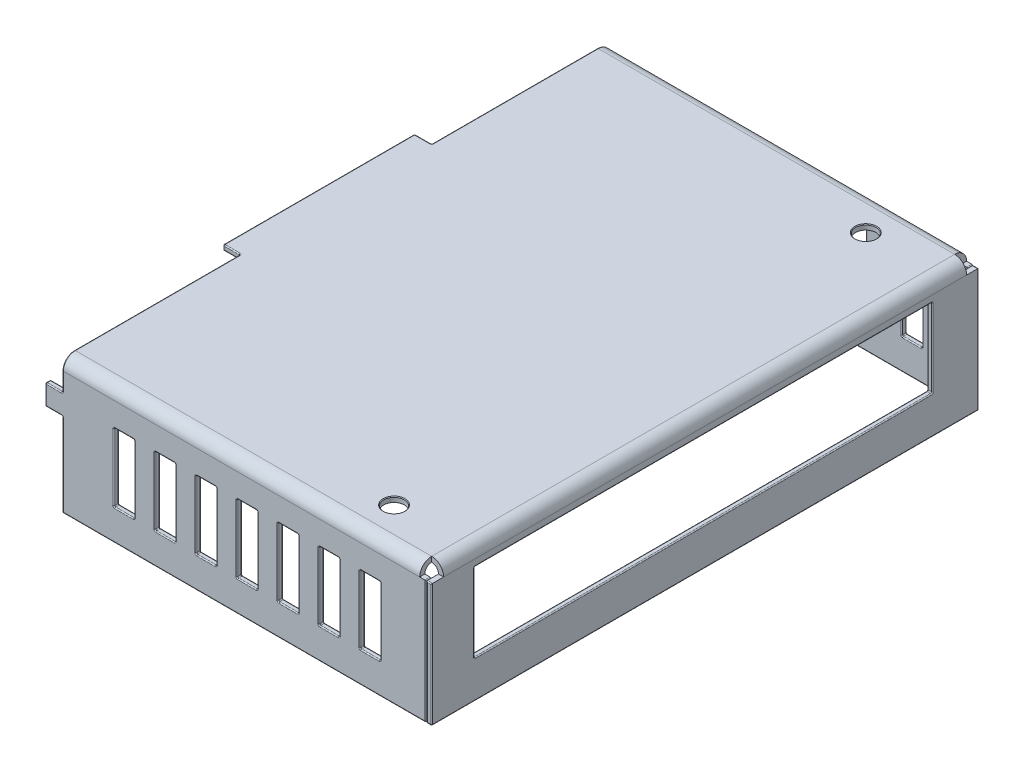
from build123d import *

# Parameters (mm, degrees)
BASE_FLANGE_DEPTH              = 53.25
SKETCH2_W                      = 2.5
SKETCH2_H                      = 28
TOP_TAB_DEPTH                  = 0.75
SKETCH5_W                      = 2.5
SKETCH5_H                      = 3
SIDE_TAB_1_DEPTH               = 0.75
EDGE_FLANGE_START              = -40
EDGE_FLANGE_DEPTH              = 80
EDGE_FLANGE_2_DEPTH            = 1.75
EDGE_FLANGE_START_2            = 38.25
EDGE_FLANGE_3_DEPTH            = 1.75
EDGE_FLANGE_START_3            = -38.25
EDGE_FLANGE_4_DEPTH            = 76.5
CLOSED_START                   = 53.15
CLOSED_CORNER_OUTLINE_W        = 18
CLOSED_CORNER_OUTLINE_H        = 0.75
CLOSED_CORNER_DEPTH            = 0.1
CLOSED_START_2                 = 53.25
CLOSED_CORNER_2_OUTLINE_W      = 18
CLOSED_CORNER_2_OUTLINE_H      = 1.75
CLOSED_CORNER_2_DEPTH          = 0.75
VENTILATION_HOLES_L_REACH      = 100.519
VENTILATION_HOLES_L_SKETCH_W   = 3
VENTILATION_HOLES_L_SKETCH_H   = 10
VENTILATION_HOLES_R_REACH      = 100.519
VENTILATION_HOLES_R_SKETCH_W   = 3
VENTILATION_HOLES_R_SKETCH_H   = 10
VENTILATION_HOLES_R_SKETCH_W_2 = 19
VENTILATION_HOLES_R_SKETCH_H_2 = 10.5
FRONT_HOLES_REACH              = 73.988
FRONT_HOLES_SKETCH_W           = 67
FRONT_HOLES_SKETCH_H           = 11.5
F_3_0_3_HOLES_D                = 3
F_3_0_3_HOLES_DEPTH            = 5.5
F_3_0_3_HOLES_CSINK_D          = 3.2
F_3_0_3_HOLES_CSINK_ANGLE      = 90
F_3_0_3_HOLES_TIP              = 0.901290929
PRODUCTION_FILLET_1_R          = 0.15


# Read off the part's stored shape, not the designer's step: Base-Flange, Edge-Flange, Closed Corner
# Sheet-metal steps are written as plain solids
with BuildPart() as part:
    # Base-Flange outline → Base-Flange (new body)
    with BuildSketch(Plane(origin=(0, 0, 0), x_dir=(0, 0, -1), z_dir=(1, 0, 0))):
        with BuildLine():
            Line((39.25, -1.75), (39.25, -19.75))
            Line((39.25, -19.75), (40, -19.75))
            Line((40, -19.75), (40, -1.75))
            ThreePointArc((40, -1.75), (39.487436867, -0.512563133), (38.25, 0))
            Line((38.25, 0), (-38.25, 0))
            ThreePointArc((-38.25, 0), (-39.487436867, -0.512563133), (-40, -1.75))
            Line((-40, -1.75), (-40, -19.75))
            Line((-40, -19.75), (-39.25, -19.75))
            Line((-39.25, -19.75), (-39.25, -1.75))
            ThreePointArc((-39.25, -1.75), (-38.957106781, -1.042893219), (-38.25, -0.75))
            Line((-38.25, -0.75), (38.25, -0.75))
            ThreePointArc((38.25, -0.75), (38.957106781, -1.042893219), (39.25, -1.75))
        make_face()
    extrude(amount=BASE_FLANGE_DEPTH)

    # Sketch2 → Top Tab (add)
    with BuildSketch(Plane(origin=(0, 0, 0), x_dir=(1, 0, 0), z_dir=(0, 1, 0))):
        with Locations((-1.25, 0)):
            Rectangle(SKETCH2_W, SKETCH2_H)
    extrude(amount=-TOP_TAB_DEPTH)

    # Sketch5 → Side Tab 1 (add)
    with BuildSketch(Plane.XY.offset(40)):
        with Locations((-1.25, -6)):
            Rectangle(SKETCH5_W, SKETCH5_H)
    side_tab_1 = extrude(amount=-SIDE_TAB_1_DEPTH)

    # Side Tab 2: Side Tab 1 across plane
    add(side_tab_1.mirror(Plane.XY))

    # Edge-Flange outline → Edge-Flange (cut)
    with BuildSketch(Plane.XY.offset(EDGE_FLANGE_START)):
        with BuildLine():
            Line((52.25, -1.75), (53.25, -1.75))
            ThreePointArc((53.25, -1.75), (52.957106781, -1.042893219), (52.25, -0.75))
            Line((52.25, -0.75), (52.25, -1.75))
        make_face()
        with BuildLine():
            Line((53.25, 0), (52.25, 0))
            ThreePointArc((52.25, 0), (52.774048587, -0.08030749), (53.25, -0.313859338))
            Line((53.25, -0.313859338), (53.25, 0))
        make_face()
    extrude(amount=EDGE_FLANGE_DEPTH, mode=Mode.SUBTRACT)

    # Edge-Flange 2 outline → Edge-Flange 2 (cut)
    with BuildSketch(Plane.XY.offset(EDGE_FLANGE_START)):
        with BuildLine():
            ThreePointArc((52.25, -0.75), (52.957106781, -1.042893219), (53.25, -1.75))
            Line((53.25, -1.75), (53.25, -0.313859338))
            ThreePointArc((53.25, -0.313859338), (52.774048587, -0.08030749), (52.25, 0))
            Line((52.25, 0), (52.25, -0.75))
        make_face()
    extrude(amount=EDGE_FLANGE_2_DEPTH, mode=Mode.SUBTRACT)

    # Edge-Flange 3 outline → Edge-Flange 3 (cut)
    with BuildSketch(Plane.XY.offset(EDGE_FLANGE_START_2)):
        with BuildLine():
            ThreePointArc((52.25, -0.75), (52.957106781, -1.042893219), (53.25, -1.75))
            Line((53.25, -1.75), (53.25, -0.313859338))
            ThreePointArc((53.25, -0.313859338), (52.774048587, -0.08030749), (52.25, 0))
            Line((52.25, 0), (52.25, -0.75))
        make_face()
    extrude(amount=EDGE_FLANGE_3_DEPTH, mode=Mode.SUBTRACT)

    # Edge-Flange 4 outline → Edge-Flange 4 (add)
    with BuildSketch(Plane.XY.offset(EDGE_FLANGE_START_3)):
        with BuildLine():
            Line((53.25, -0.313859338), (53.25, -0.75))
            Line((53.25, -0.75), (52.25, -0.75))
            ThreePointArc((52.25, -0.75), (52.957106781, -1.042893219), (53.25, -1.75))
            Line((53.25, -1.75), (53.25, -19.75))
            Line((53.25, -19.75), (54, -19.75))
            Line((54, -19.75), (54, -1.75))
            ThreePointArc((54, -1.75), (53.801209206, -0.939907413), (53.25, -0.313859338))
        make_face()
    extrude(amount=EDGE_FLANGE_4_DEPTH)

    # Closed Corner outline → Closed Corner (cut)
    with BuildSketch(Plane.YZ.offset(CLOSED_START)):
        with Locations((-10.75, 39.625)):
            Rectangle(CLOSED_CORNER_OUTLINE_W, CLOSED_CORNER_OUTLINE_H)
        with Locations((-10.75, -39.625)):
            Rectangle(CLOSED_CORNER_OUTLINE_W, CLOSED_CORNER_OUTLINE_H)
    extrude(amount=CLOSED_CORNER_DEPTH, mode=Mode.SUBTRACT)

    # Closed Corner 2 outline → Closed Corner 2 (add)
    with BuildSketch(Plane.YZ.offset(CLOSED_START_2)):
        with Locations((-10.75, -39.125)):
            Rectangle(CLOSED_CORNER_2_OUTLINE_W, CLOSED_CORNER_2_OUTLINE_H)
        with Locations((-10.75, 39.125)):
            Rectangle(CLOSED_CORNER_2_OUTLINE_W, CLOSED_CORNER_2_OUTLINE_H)
    extrude(amount=CLOSED_CORNER_2_DEPTH)

    # Ventilation Holes L Sketch → Ventilation Holes L (cut, up to next)
    with BuildSketch(Plane.XY.offset(40), mode=Mode.PRIVATE) as ventilation_holes_l_sk1:
        with Locations((9, -10.25)):
            Rectangle(VENTILATION_HOLES_L_SKETCH_W, VENTILATION_HOLES_L_SKETCH_H)
    ventilation_holes_l_tool1 = extrude(ventilation_holes_l_sk1.sketch, amount=-VENTILATION_HOLES_L_REACH, mode=Mode.PRIVATE) & part.part
    # Ventilation Holes L Sketch → Ventilation Holes L (cut, up to next)
    with BuildSketch(Plane.XY.offset(40), mode=Mode.PRIVATE) as ventilation_holes_l_sk2:
        with Locations((15, -10.25)):
            Rectangle(VENTILATION_HOLES_L_SKETCH_W, VENTILATION_HOLES_L_SKETCH_H)
    ventilation_holes_l_tool2 = extrude(ventilation_holes_l_sk2.sketch, amount=-VENTILATION_HOLES_L_REACH, mode=Mode.PRIVATE) & part.part
    # Ventilation Holes L Sketch → Ventilation Holes L (cut, up to next)
    with BuildSketch(Plane.XY.offset(40), mode=Mode.PRIVATE) as ventilation_holes_l_sk3:
        with Locations((21, -10.25)):
            Rectangle(VENTILATION_HOLES_L_SKETCH_W, VENTILATION_HOLES_L_SKETCH_H)
    ventilation_holes_l_tool3 = extrude(ventilation_holes_l_sk3.sketch, amount=-VENTILATION_HOLES_L_REACH, mode=Mode.PRIVATE) & part.part
    # Ventilation Holes L Sketch → Ventilation Holes L (cut, up to next)
    with BuildSketch(Plane.XY.offset(40), mode=Mode.PRIVATE) as ventilation_holes_l_sk4:
        with Locations((27, -10.25)):
            Rectangle(VENTILATION_HOLES_L_SKETCH_W, VENTILATION_HOLES_L_SKETCH_H)
    ventilation_holes_l_tool4 = extrude(ventilation_holes_l_sk4.sketch, amount=-VENTILATION_HOLES_L_REACH, mode=Mode.PRIVATE) & part.part
    # Ventilation Holes L Sketch → Ventilation Holes L (cut, up to next)
    with BuildSketch(Plane.XY.offset(40), mode=Mode.PRIVATE) as ventilation_holes_l_sk5:
        with Locations((33, -10.25)):
            Rectangle(VENTILATION_HOLES_L_SKETCH_W, VENTILATION_HOLES_L_SKETCH_H)
    ventilation_holes_l_tool5 = extrude(ventilation_holes_l_sk5.sketch, amount=-VENTILATION_HOLES_L_REACH, mode=Mode.PRIVATE) & part.part
    # Ventilation Holes L Sketch → Ventilation Holes L (cut, up to next)
    with BuildSketch(Plane.XY.offset(40), mode=Mode.PRIVATE) as ventilation_holes_l_sk6:
        with Locations((39, -10.25)):
            Rectangle(VENTILATION_HOLES_L_SKETCH_W, VENTILATION_HOLES_L_SKETCH_H)
    ventilation_holes_l_tool6 = extrude(ventilation_holes_l_sk6.sketch, amount=-VENTILATION_HOLES_L_REACH, mode=Mode.PRIVATE) & part.part
    # Ventilation Holes L Sketch → Ventilation Holes L (cut, up to next)
    with BuildSketch(Plane.XY.offset(40), mode=Mode.PRIVATE) as ventilation_holes_l_sk7:
        with Locations((45, -10.25)):
            Rectangle(VENTILATION_HOLES_L_SKETCH_W, VENTILATION_HOLES_L_SKETCH_H)
    ventilation_holes_l_tool7 = extrude(ventilation_holes_l_sk7.sketch, amount=-VENTILATION_HOLES_L_REACH, mode=Mode.PRIVATE) & part.part
    add(ventilation_holes_l_tool1.solids().sort_by_distance((9, -10.25, 40))[0], mode=Mode.SUBTRACT)
    add(ventilation_holes_l_tool2.solids().sort_by_distance((15, -10.25, 40))[0], mode=Mode.SUBTRACT)
    add(ventilation_holes_l_tool3.solids().sort_by_distance((21, -10.25, 40))[0], mode=Mode.SUBTRACT)
    add(ventilation_holes_l_tool4.solids().sort_by_distance((27, -10.25, 40))[0], mode=Mode.SUBTRACT)
    add(ventilation_holes_l_tool5.solids().sort_by_distance((33, -10.25, 40))[0], mode=Mode.SUBTRACT)
    add(ventilation_holes_l_tool6.solids().sort_by_distance((39, -10.25, 40))[0], mode=Mode.SUBTRACT)
    add(ventilation_holes_l_tool7.solids().sort_by_distance((45, -10.25, 40))[0], mode=Mode.SUBTRACT)

    # Ventilation Holes R Sketch → Ventilation Holes R (cut, up to next)
    with BuildSketch(Plane(origin=(0, 0, -40), x_dir=(-1, 0, 0), z_dir=(0, 0, -1)), mode=Mode.PRIVATE) as ventilation_holes_r_sk1:
        with Locations((-9, -10.25)):
            Rectangle(VENTILATION_HOLES_R_SKETCH_W, VENTILATION_HOLES_R_SKETCH_H)
    ventilation_holes_r_tool1 = extrude(ventilation_holes_r_sk1.sketch, amount=-VENTILATION_HOLES_R_REACH, mode=Mode.PRIVATE) & part.part
    # Ventilation Holes R Sketch → Ventilation Holes R (cut, up to next)
    with BuildSketch(Plane(origin=(0, 0, -40), x_dir=(-1, 0, 0), z_dir=(0, 0, -1)), mode=Mode.PRIVATE) as ventilation_holes_r_sk2:
        with Locations((-15, -10.25)):
            Rectangle(VENTILATION_HOLES_R_SKETCH_W, VENTILATION_HOLES_R_SKETCH_H)
    ventilation_holes_r_tool2 = extrude(ventilation_holes_r_sk2.sketch, amount=-VENTILATION_HOLES_R_REACH, mode=Mode.PRIVATE) & part.part
    # Ventilation Holes R Sketch → Ventilation Holes R (cut, up to next)
    with BuildSketch(Plane(origin=(0, 0, -40), x_dir=(-1, 0, 0), z_dir=(0, 0, -1)), mode=Mode.PRIVATE) as ventilation_holes_r_sk3:
        with Locations((-45, -10.25)):
            Rectangle(VENTILATION_HOLES_R_SKETCH_W, VENTILATION_HOLES_R_SKETCH_H)
    ventilation_holes_r_tool3 = extrude(ventilation_holes_r_sk3.sketch, amount=-VENTILATION_HOLES_R_REACH, mode=Mode.PRIVATE) & part.part
    # Ventilation Holes R Sketch → Ventilation Holes R (cut, up to next)
    with BuildSketch(Plane(origin=(0, 0, -40), x_dir=(-1, 0, 0), z_dir=(0, 0, -1)), mode=Mode.PRIVATE) as ventilation_holes_r_sk4:
        with Locations((-28.75, -8)):
            Rectangle(VENTILATION_HOLES_R_SKETCH_W_2, VENTILATION_HOLES_R_SKETCH_H_2)
    ventilation_holes_r_tool4 = extrude(ventilation_holes_r_sk4.sketch, amount=-VENTILATION_HOLES_R_REACH, mode=Mode.PRIVATE) & part.part
    add(ventilation_holes_r_tool1.solids().sort_by_distance((9, -10.25, -40))[0], mode=Mode.SUBTRACT)
    add(ventilation_holes_r_tool2.solids().sort_by_distance((15, -10.25, -40))[0], mode=Mode.SUBTRACT)
    add(ventilation_holes_r_tool3.solids().sort_by_distance((45, -10.25, -40))[0], mode=Mode.SUBTRACT)
    add(ventilation_holes_r_tool4.solids().sort_by_distance((28.75, -8, -40))[0], mode=Mode.SUBTRACT)

    # Front Holes Sketch → Front Holes (cut, up to next)
    with BuildSketch(Plane(origin=(54, 0, 0), x_dir=(0, 0, -1), z_dir=(1, 0, 0)), mode=Mode.PRIVATE) as front_holes_sk1:
        with Locations((-0.25, -8.5)):
            Rectangle(FRONT_HOLES_SKETCH_W, FRONT_HOLES_SKETCH_H)
    front_holes_tool1 = extrude(front_holes_sk1.sketch, amount=-FRONT_HOLES_REACH, mode=Mode.PRIVATE) & part.part
    add(front_holes_tool1.solids().sort_by_distance((54, -8.5, 0.25))[0], mode=Mode.SUBTRACT)

    # Ø3.0 (3) Holes
    with Locations(Plane(origin=(0, 0, 0), x_dir=(1, 0, 0), z_dir=(0, 1, 0))):
        with Locations((43, -34.5), (43, 34.5)):
            CounterSinkHole(F_3_0_3_HOLES_D / 2, F_3_0_3_HOLES_CSINK_D / 2, depth=F_3_0_3_HOLES_DEPTH, counter_sink_angle=F_3_0_3_HOLES_CSINK_ANGLE)
            with Locations((0, 0, -(F_3_0_3_HOLES_DEPTH + F_3_0_3_HOLES_TIP / 2))):  # 118° drill point
                Cone(0, F_3_0_3_HOLES_D / 2, F_3_0_3_HOLES_TIP, mode=Mode.SUBTRACT)

    # Production Fillet 1
    production_fillet_1_edges = [part.edges().sort_by_distance(p)[0] for p in [
        (0, -0.75, 26.125),
        (0, 0, 26.125),
        (0, -1.042893219, 38.957106781),
        (0, -0.512563133, 39.487436867),
        (53.15, -19.75, 39.625),
        (26.575, -19.75, 40),
        (0, -19.75, 39.625),
        (0, -13.625, 40),
        (-1.25, -7.5, 39.25),
        (0, -7.5, 39.625),
        (-2.5, -6, 39.25),
        (-2.5, -7.5, 39.625),
        (-1.25, -4.5, 39.25),
        (-2.5, -4.5, 39.625),
        (53.15, -1.75, 39.625),
        (53.15, -10.75, 40),
        (-1.25, -4.5, 40),
        (-2.5, -6, 40),
        (-1.25, -7.5, 40),
        (0, -4.5, 39.625),
        (0, -3.125, 40),
        (53.15, -10.75, 39.25),
        (26.575, -19.75, 39.25),
        (0, -13.625, 39.25),
        (0, -3.125, 39.25),
        (54, -10.75, -40),
        (53.625, -19.75, -40),
        (53.25, -19.75, 0),
        (53.625, -19.75, 40),
        (53.25, -10.75, 40),
        (53.625, -1.75, 40),
        (54, -10.75, 40),
        (54, -19.75, 0),
        (53.25, -10.75, -40),
        (53.625, -1.75, -40),
        (0, -0.75, -26.125),
        (0, 0, -26.125),
        (-2.5, -0.75, 0),
        (-2.5, -0.375, 14),
        (-1.25, -0.75, -14),
        (0, -1.042893219, -38.957106781),
        (-2.5, -0.375, -14),
        (0, -0.512563133, -39.487436867),
        (0, -0.375, -14),
        (-1.25, -0.75, 14),
        (0, -0.375, 14),
        (-1.25, -4.5, -40),
        (-2.5, 0, 0),
        (0, -4.5, -39.625),
        (-2.5, -6, -40),
        (-2.5, -4.5, -39.625),
        (-1.25, -7.5, -40),
        (-2.5, -7.5, -39.625),
        (0, -7.5, -39.625),
        (0, -13.625, -40),
        (0, -19.75, -39.625),
        (53.15, -19.75, -39.625),
        (26.575, -19.75, -39.25),
        (53.15, -1.75, -39.625),
        (53.15, -10.75, -39.25),
        (53.15, -10.75, -40),
        (26.575, -19.75, -40),
        (0, -3.125, -39.25),
        (-1.25, -4.5, -39.25),
        (-2.5, -6, -39.25),
        (-1.25, -7.5, -39.25),
        (0, -13.625, -39.25),
        (-1.25, 0, 14),
        (0, -3.125, -40),
        (-1.25, 0, -14),
        (10.5, -5.25, 39.625),
        (10.5, -15.25, 39.625),
        (7.5, -15.25, 39.625),
        (7.5, -5.25, 39.625),
        (10.5, -10.25, 40),
        (9, -5.25, 40),
        (7.5, -10.25, 40),
        (9, -15.25, 40),
        (9, -5.25, 39.25),
        (10.5, -10.25, 39.25),
        (9, -15.25, 39.25),
        (7.5, -10.25, 39.25),
        (16.5, -15.25, 39.625),
        (13.5, -15.25, 39.625),
        (13.5, -5.25, 39.625),
        (16.5, -5.25, 39.625),
        (15, -15.25, 40),
        (16.5, -10.25, 40),
        (15, -5.25, 40),
        (13.5, -10.25, 40),
        (16.5, -10.25, 39.25),
        (15, -15.25, 39.25),
        (13.5, -10.25, 39.25),
        (15, -5.25, 39.25),
        (22.5, -15.25, 39.625),
        (19.5, -15.25, 39.625),
        (19.5, -5.25, 39.625),
        (22.5, -5.25, 39.625),
        (21, -15.25, 40),
        (22.5, -10.25, 40),
        (21, -5.25, 40),
        (19.5, -10.25, 40),
        (22.5, -10.25, 39.25),
        (21, -15.25, 39.25),
        (19.5, -10.25, 39.25),
        (21, -5.25, 39.25),
        (28.5, -15.25, 39.625),
        (25.5, -15.25, 39.625),
        (25.5, -5.25, 39.625),
        (28.5, -5.25, 39.625),
        (27, -15.25, 40),
        (28.5, -10.25, 40),
        (27, -5.25, 40),
        (25.5, -10.25, 40),
        (28.5, -10.25, 39.25),
        (27, -15.25, 39.25),
        (25.5, -10.25, 39.25),
        (27, -5.25, 39.25),
        (34.5, -15.25, 39.625),
        (31.5, -15.25, 39.625),
        (31.5, -5.25, 39.625),
        (34.5, -5.25, 39.625),
        (33, -15.25, 40),
        (34.5, -10.25, 40),
        (33, -5.25, 40),
        (31.5, -10.25, 40),
        (34.5, -10.25, 39.25),
        (33, -15.25, 39.25),
        (31.5, -10.25, 39.25),
        (33, -5.25, 39.25),
        (40.5, -15.25, 39.625),
        (37.5, -15.25, 39.625),
        (37.5, -5.25, 39.625),
        (40.5, -5.25, 39.625),
        (39, -15.25, 40),
        (40.5, -10.25, 40),
        (39, -5.25, 40),
        (37.5, -10.25, 40),
        (40.5, -10.25, 39.25),
        (39, -15.25, 39.25),
        (37.5, -10.25, 39.25),
        (39, -5.25, 39.25),
        (46.5, -15.25, 39.625),
        (43.5, -15.25, 39.625),
        (43.5, -5.25, 39.625),
        (46.5, -5.25, 39.625),
        (45, -15.25, 40),
        (46.5, -10.25, 40),
        (45, -5.25, 40),
        (43.5, -10.25, 40),
        (46.5, -10.25, 39.25),
        (45, -15.25, 39.25),
        (43.5, -10.25, 39.25),
        (45, -5.25, 39.25),
        (9, -5.25, -39.25),
        (7.5, -10.25, -39.25),
        (9, -15.25, -39.25),
        (10.5, -10.25, -39.25),
        (7.5, -5.25, -39.625),
        (7.5, -15.25, -39.625),
        (10.5, -15.25, -39.625),
        (10.5, -5.25, -39.625),
        (7.5, -10.25, -40),
        (9, -5.25, -40),
        (10.5, -10.25, -40),
        (9, -15.25, -40),
        (13.5, -10.25, -39.25),
        (15, -15.25, -39.25),
        (16.5, -10.25, -39.25),
        (15, -5.25, -39.25),
        (13.5, -15.25, -39.625),
        (16.5, -15.25, -39.625),
        (16.5, -5.25, -39.625),
        (13.5, -5.25, -39.625),
        (15, -15.25, -40),
        (13.5, -10.25, -40),
        (15, -5.25, -40),
        (16.5, -10.25, -40),
        (28.75, -2.75, -39.25),
        (19.25, -8, -39.25),
        (28.75, -13.25, -39.25),
        (38.25, -8, -39.25),
        (19.25, -8, -40),
        (28.75, -2.75, -40),
        (38.25, -8, -40),
        (28.75, -13.25, -40),
        (38.25, -2.75, -39.625),
        (38.25, -13.25, -39.625),
        (19.25, -13.25, -39.625),
        (19.25, -2.75, -39.625),
        (43.5, -10.25, -39.25),
        (45, -15.25, -39.25),
        (46.5, -10.25, -39.25),
        (45, -5.25, -39.25),
        (43.5, -15.25, -39.625),
        (46.5, -15.25, -39.625),
        (46.5, -5.25, -39.625),
        (43.5, -5.25, -39.625),
        (45, -15.25, -40),
        (43.5, -10.25, -40),
        (45, -5.25, -40),
        (46.5, -10.25, -40),
        (53.25, -8.5, -33.25),
        (53.625, -2.75, -33.25),
        (53.25, -14.25, 0.25),
        (53.625, -14.25, -33.25),
        (53.25, -8.5, 33.75),
        (53.625, -14.25, 33.75),
        (53.25, -2.75, 0.25),
        (53.625, -2.75, 33.75),
        (54, -8.5, -33.25),
        (54, -2.75, 0.25),
        (54, -8.5, 33.75),
        (54, -14.25, 0.25),
    ]]
    fillet(production_fillet_1_edges, radius=PRODUCTION_FILLET_1_R)


solid = part.part
